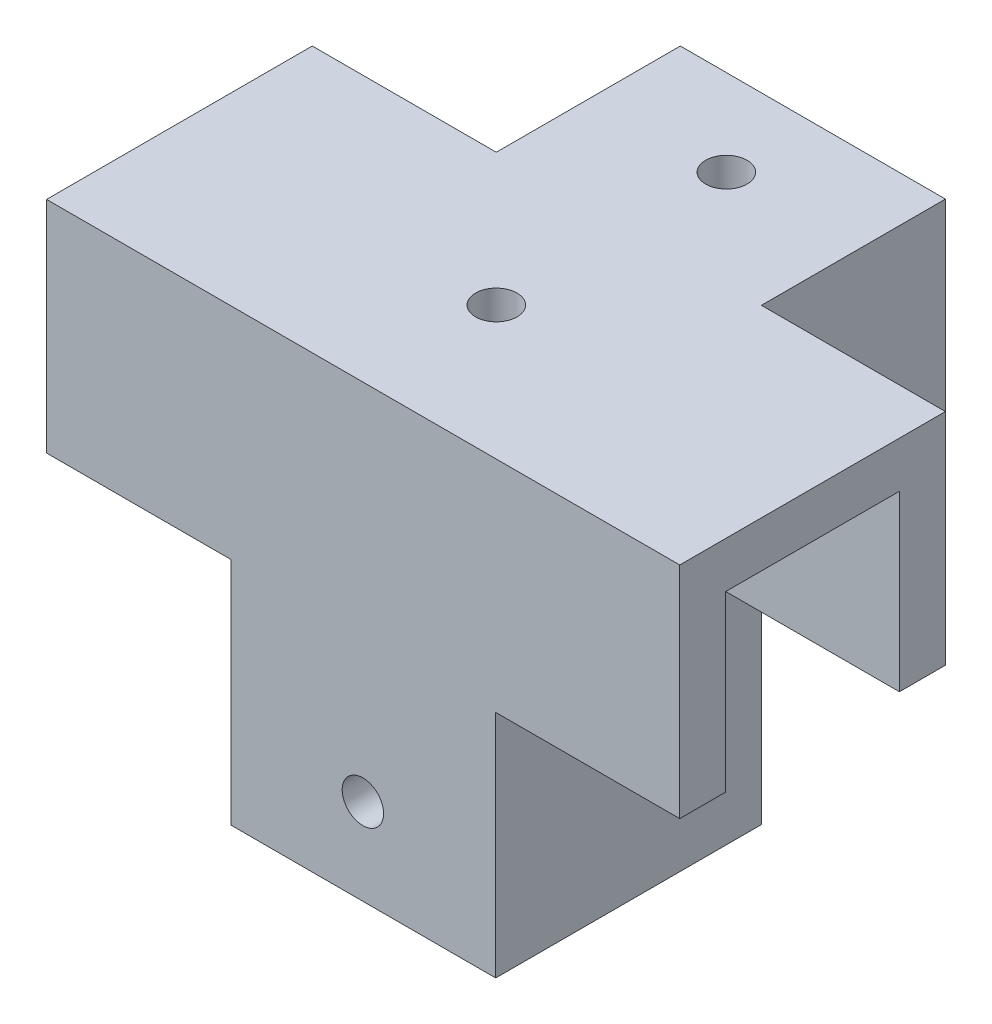
from build123d import *

# Parameters (mm, degrees)
SKETCH_1_W          = 55.05
SKETCH_1_H          = 4
EXTRUDE_1_DEPTH     = 15.1
EXTRUDE_1_2_DEPTH   = 15.1
EXTRUDE_1_3_DEPTH   = 15.1
EXTRUDE_2_DEPTH     = 4
SKETCH_3_W          = 23
SKETCH_3_H          = 23.1
SKETCH_3_W_2        = 15.15
SKETCH_3_H_2        = 15.1
EXTRUDE_3_DEPTH     = 20
SKETCH_4_R          = 1.8
CUT_EXTRUDE_1_DEPTH = 20
SKETCH_5_R          = 1.8
CUT_EXTRUDE_2_DEPTH = 27


with BuildPart() as part:
    # 草图1 → 凸台-拉伸1 (new body)
    with BuildSketch(Plane(origin=(0, 0, 0), x_dir=(1, 0, 0), z_dir=(0, 1, 0))):
        with Locations((5.494230769, -11.715384615)):
            Rectangle(SKETCH_1_W, SKETCH_1_H)
    extrude(amount=EXTRUDE_1_DEPTH)



with BuildPart() as body_2:
    # 草图1 → Extrude 1 2 (new body)
    with BuildSketch(Plane(origin=(0, 0, 0), x_dir=(1, 0, 0), z_dir=(0, 1, 0))):
        Polygon((-6.030769231, 9.384615385), (-22.030769231, 9.384615385), (-22.030769231, 5.384615385), (-2.030769231, 5.384615385), (-2.030769231, 25.384615385), (-6.030769231, 25.384615385), align=None)
    extrude(amount=EXTRUDE_1_2_DEPTH)


with BuildPart() as body_3:
    # 草图1 → Extrude 1 3 (new body)
    with BuildSketch(Plane(origin=(0, 0, 0), x_dir=(1, 0, 0), z_dir=(0, 1, 0))):
        Polygon((13.019230769, 5.384615385), (33.019230769, 5.384615385), (33.019230769, 9.384615385), (17.019230769, 9.384615385), (17.019230769, 25.384615385), (13.019230769, 25.384615385), align=None)
    extrude(amount=EXTRUDE_1_3_DEPTH)


with BuildPart() as part_1:
    add(part.part)

    add(body_2.part)  # 凸台-拉伸2 merges body 2

    add(body_3.part)  # 凸台-拉伸2 merges body 3
    # 草图2 → 凸台-拉伸2 (add)
    with BuildSketch(Plane(origin=(0, 15.1, 0), x_dir=(1, 0, 0), z_dir=(0, 1, 0))):
        Polygon((-6.030769231, 9.384615385), (-22.030769231, 9.384615385), (-22.030769231, -13.715384615), (33.019230769, -13.715384615), (33.019230769, 9.384615385), (17.019230769, 9.384615385), (17.019230769, 25.384615385), (-6.030769231, 25.384615385), align=None)
    extrude(amount=EXTRUDE_2_DEPTH)

    # 草图3 → 凸台-拉伸3 (add)
    with BuildSketch(Plane.XZ):
        with Locations((5.519230769, 2.165384615)):
            Rectangle(SKETCH_3_W, SKETCH_3_H)
        with Locations((5.444230769, 2.165384615)):
            Rectangle(SKETCH_3_W_2, SKETCH_3_H_2, mode=Mode.SUBTRACT)
    extrude(amount=EXTRUDE_3_DEPTH)

    # 草图4 → 切除-拉伸1 (cut)
    with BuildSketch(Plane(origin=(0, 19.1, 0), x_dir=(1, 0, 0), z_dir=(0, 1, 0))):
        with Locations((5.469230769, 17.884615385)):
            Circle(SKETCH_4_R)
        with Locations((5.469230769, -2.115384615)):
            Circle(SKETCH_4_R)
    extrude(amount=-CUT_EXTRUDE_1_DEPTH, mode=Mode.SUBTRACT)

    # 草图5 → 切除-拉伸2 (cut)
    with BuildSketch(Plane.XY.offset(13.715384615)):
        with Locations((5.469230769, -12.5)):
            Circle(SKETCH_5_R)
    extrude(amount=-CUT_EXTRUDE_2_DEPTH, mode=Mode.SUBTRACT)


solid = part_1.part
